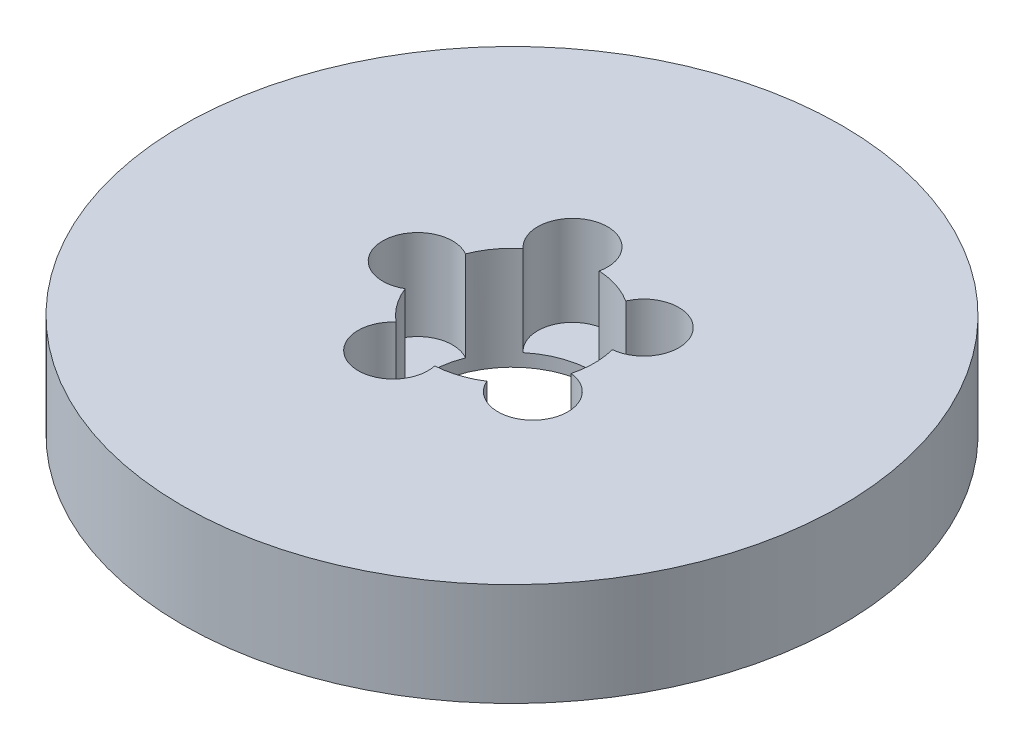
from build123d import *

# Parameters (mm, degrees)
SKETCH1_R           = 80
BOSS_EXTRUDE1_DEPTH = 25
SKETCH2_R           = 20
CUT_EXTRUDE1_DEPTH  = 116.866302263
SKETCH3_R           = 8.489176296
CUT_EXTRUDE2_DEPTH  = 21.870380612
CIRPATTERN1_COUNT   = 5


with BuildPart() as part:
    # Sketch1 → Boss-Extrude1 (new body)
    with BuildSketch(Plane(origin=(0, 0, 0), x_dir=(1, 0, 0), z_dir=(0, 1, 0))):
        Circle(SKETCH1_R)
    extrude(amount=BOSS_EXTRUDE1_DEPTH)

    # Sketch2 → Cut-Extrude1 (cut, through all)
    with BuildSketch(Plane(origin=(0, 0, 0), x_dir=(1, 0, 0), z_dir=(0, 1, 0))):
        Circle(SKETCH2_R)
    extrude(amount=CUT_EXTRUDE1_DEPTH, mode=Mode.SUBTRACT)

    # Sketch3 → Cut-Extrude2 (cut)
    with BuildSketch(Plane(origin=(0, 25, 0), x_dir=(1, 0, 0), z_dir=(0, 1, 0))):
        with Locations((-22.907156069, 0)):
            Circle(SKETCH3_R)
    cut_extrude2 = extrude(amount=-CUT_EXTRUDE2_DEPTH, mode=Mode.SUBTRACT)

    # CirPattern1: Cut-Extrude2 ×5 about axis
    cirpattern1_axis = Axis((0, 0, 0), (0, 1, 0))
    for i in range(1, CIRPATTERN1_COUNT):
        add(cut_extrude2.rotate(cirpattern1_axis, i * 360 / CIRPATTERN1_COUNT), mode=Mode.SUBTRACT)


solid = part.part
